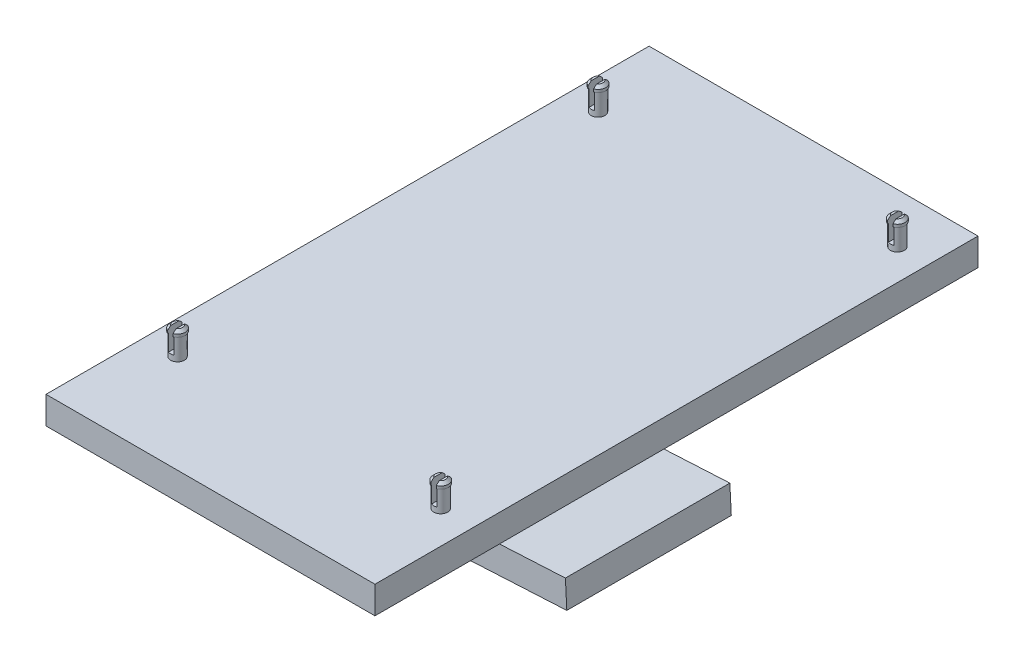
from build123d import *

# Parameters (mm, degrees)
BOSS_EXTRUDE1_DEPTH = 15
SKETCH2_W           = 60
SKETCH2_H           = 110
BOSS_EXTRUDE2_DEPTH = 5
SKETCH3_R           = 1.25
BOSS_EXTRUDE3_DEPTH = 4
SKETCH4_R           = 1.405
BOSS_EXTRUDE4_DEPTH = 1
CHAMFER1_SIZE       = 0.5
SKETCH5_W           = 1
SKETCH5_H           = 3.260897444
CUT_EXTRUDE1_DEPTH  = 4
MIRROR1_START       = 28
MIRROR1_DEPTH       = 6
MIRROR1_2_DEPTH     = 2
MIRROR1_START_2     = 33
MIRROR1_3_DEPTH     = 1
SKETCH7_R           = 1.25
BOSS_EXTRUDE5_DEPTH = 4
SKETCH8_R           = 1.405
BOSS_EXTRUDE6_DEPTH = 1
CHAMFER2_SIZE       = 0.5
SKETCH9_W           = 1
SKETCH9_H           = 4.099421272
SKETCH9_H_2         = 4.814063164
CUT_EXTRUDE2_DEPTH  = 4


with BuildPart() as part:
    # Sketch1 → Boss-Extrude1 (new, symmetric)
    with BuildSketch(Plane.XY):
        Polygon((0, 0), (10, 0), (55, 2.358350068), (54.738678842, 7.344654806), (10, 5), (5, 5), (5, 24), (60, 24), (60, 29), (0, 29), align=None)
    extrude(amount=BOSS_EXTRUDE1_DEPTH, both=True)

    # Sketch2 → Boss-Extrude2 (add)
    with BuildSketch(Plane(origin=(0, 29, 0), x_dir=(1, 0, 0), z_dir=(0, 1, 0))):
        with Locations((30, 0)):
            Rectangle(SKETCH2_W, SKETCH2_H)
    extrude(amount=-BOSS_EXTRUDE2_DEPTH)

    # Sketch3 → Boss-Extrude3 (add)
    with BuildSketch(Plane(origin=(0, 29, 0), x_dir=(1, 0, 0), z_dir=(0, 1, 0))):
        with Locations(Location((54, -37, 0), (0, 0, 90))):
            Circle(SKETCH3_R)
    extrude(amount=BOSS_EXTRUDE3_DEPTH)

    # Sketch4 → Boss-Extrude4 (add)
    with BuildSketch(Plane(origin=(0, 33, 0), x_dir=(1, 0, 0), z_dir=(0, 1, 0))):
        with Locations(Location((54, -37, 0), (0, 0, 270))):
            Circle(SKETCH4_R)
    extrude(amount=BOSS_EXTRUDE4_DEPTH)

    # Chamfer1
    chamfer1_edges = [part.edges().sort_by_distance(p)[0] for p in [
        (54, 34, 35.595),
    ]]
    chamfer(chamfer1_edges, length=CHAMFER1_SIZE)

    # Sketch5 → Cut-Extrude1 (cut)
    with BuildSketch(Plane(origin=(0, 34, 0), x_dir=(1, 0, 0), z_dir=(0, 1, 0))):
        with Locations((54, -37)):
            Rectangle(SKETCH5_W, SKETCH5_H)
    extrude(amount=-CUT_EXTRUDE1_DEPTH, mode=Mode.SUBTRACT)

    # Mirror1: read off the stored shape, not the designer's step
    # Mirror1 outline → Mirror1 (add)
    with BuildSketch(Plane(origin=(0, 0, 0), x_dir=(1, 0, 0), z_dir=(0, 1, 0)).offset(MIRROR1_START)):
        with BuildLine():
            ThreePointArc((6.5, -38.145643924), (7.25, -37), (6.5, -35.854356076))
            Line((6.5, -35.854356076), (6.5, -38.145643924))
        make_face()
        with BuildLine():
            Line((5.5, -38.145643924), (5.5, -35.854356076))
            ThreePointArc((5.5, -35.854356076), (4.75, -37), (5.5, -38.145643924))
        make_face()
    extrude(amount=MIRROR1_DEPTH)

    # Mirror1 2 outline → Mirror1 2 (add)
    with BuildSketch(Plane(origin=(0, 0, 0), x_dir=(1, 0, 0), z_dir=(0, 1, 0)).offset(MIRROR1_START)):
        with BuildLine():
            Line((6.5, -38.145643924), (6.5, -35.854356076))
            ThreePointArc((6.5, -35.854356076), (6, -35.75), (5.5, -35.854356076))
            Line((5.5, -35.854356076), (5.5, -38.145643924))
            ThreePointArc((5.5, -38.145643924), (6, -38.25), (6.5, -38.145643924))
        make_face()
    extrude(amount=MIRROR1_2_DEPTH)

    # Mirror1 3 outline → Mirror1 3 (add)
    with BuildSketch(Plane(origin=(0, 0, 0), x_dir=(1, 0, 0), z_dir=(0, 1, 0)).offset(MIRROR1_START_2)):
        with BuildLine():
            ThreePointArc((6.5, -35.854356076), (7.25, -37), (6.5, -38.145643924))
            Line((6.5, -38.145643924), (6.5, -38.313021325))
            ThreePointArc((6.5, -38.313021325), (7.405, -37), (6.5, -35.686978675))
            Line((6.5, -35.686978675), (6.5, -35.854356076))
        make_face()
        with BuildLine():
            ThreePointArc((5.5, -38.145643924), (4.75, -37), (5.5, -35.854356076))
            Line((5.5, -35.854356076), (5.5, -35.686978675))
            ThreePointArc((5.5, -35.686978675), (4.595, -37), (5.5, -38.313021325))
            Line((5.5, -38.313021325), (5.5, -38.145643924))
        make_face()
    extrude(amount=MIRROR1_3_DEPTH)

    # Mirror1 4 outline → Mirror1 4 (revolve, cut)
    with BuildSketch(Plane(origin=(6, 0, 37), x_dir=(1, 0, 0), z_dir=(0, 0, 1))):
        Polygon((1.405000007, 34.00000007), (0.90499993, 34.00000007), (1.405000007, 33.499999993), align=None)
    revolve(axis=Axis((6, 0, 37), (0, 1, 0)), mode=Mode.SUBTRACT)

    # Sketch7 → Boss-Extrude5 (add)
    with BuildSketch(Plane(origin=(0, 29, 0), x_dir=(1, 0, 0), z_dir=(0, 1, 0))):
        with Locations(Location((54.3, 46, 0), (0, 0, 90))):
            Circle(SKETCH7_R)
        with Locations(Location((5.7, 40, 0), (0, 0, 90))):
            Circle(SKETCH7_R)
    extrude(amount=BOSS_EXTRUDE5_DEPTH)

    # Sketch8 → Boss-Extrude6 (add)
    with BuildSketch(Plane(origin=(0, 33, 0), x_dir=(1, 0, 0), z_dir=(0, 1, 0))):
        with Locations(Location((5.7, 40, 0), (0, 0, 270))):
            Circle(SKETCH8_R)
        with Locations(Location((54.3, 46, 0), (0, 0, 270))):
            Circle(SKETCH8_R)
    extrude(amount=BOSS_EXTRUDE6_DEPTH)

    # Chamfer2
    chamfer2_edges = [part.edges().sort_by_distance(p)[0] for p in [
        (5.7, 34, -41.405),
        (54.3, 34, -47.405),
    ]]
    chamfer(chamfer2_edges, length=CHAMFER2_SIZE)

    # Sketch9 → Cut-Extrude2 (cut)
    with BuildSketch(Plane(origin=(0, 34, 0), x_dir=(1, 0, 0), z_dir=(0, 1, 0))):
        with Locations((5.7, 40)):
            Rectangle(SKETCH9_W, SKETCH9_H)
        with Locations((54.3, 46)):
            Rectangle(SKETCH9_W, SKETCH9_H_2)
    extrude(amount=-CUT_EXTRUDE2_DEPTH, mode=Mode.SUBTRACT)


solid = part.part
